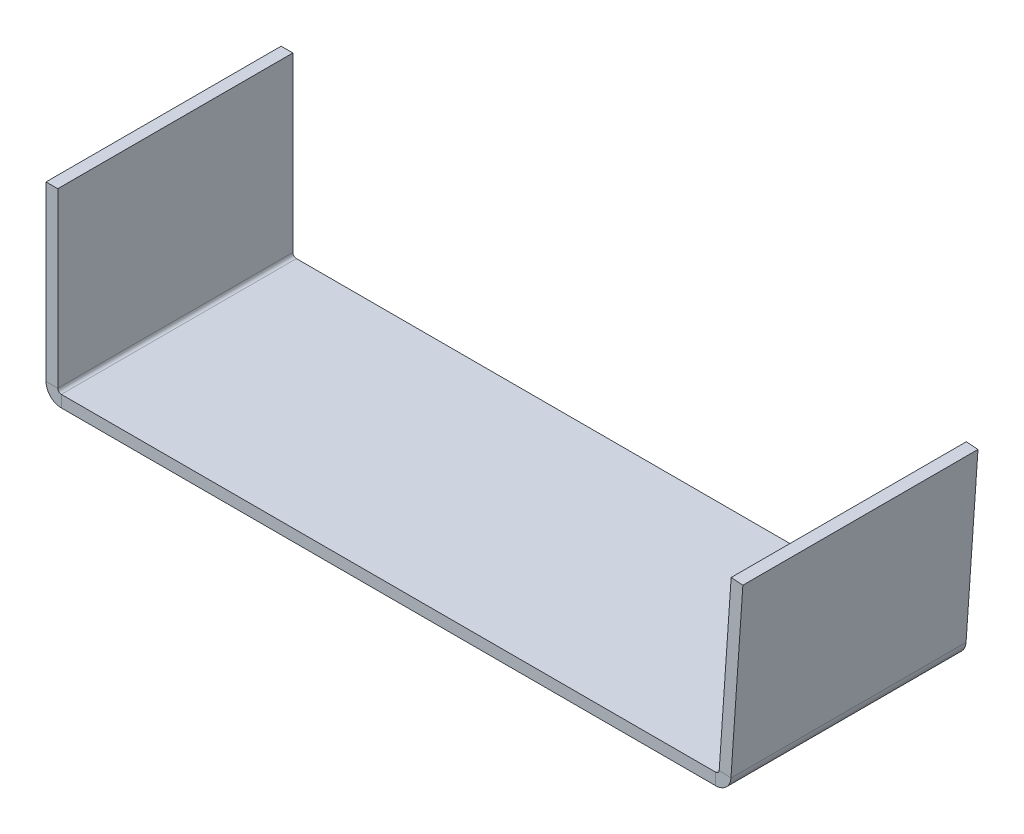
from build123d import *

# Parameters (mm, degrees)
BASE_FLANGE1_DEPTH = 40


# Sheet-metal steps are written as plain solids
with BuildPart() as part:
    # Sketch1 → Base-Flange1 (new body)
    with BuildSketch(Plane.XY):
        with BuildLine():
            Line((-58.181789665, 32.32321648), (-58.181789665, 2.927271587))
            ThreePointArc((-58.181789665, 2.927271587), (-58.006053734, 2.503007518), (-57.581789665, 2.327271587))
            Line((-57.581789665, 2.327271587), (53.742957817, 2.327271587))
            ThreePointArc((53.742957817, 2.327271587), (54.152366688, 2.488655152), (54.341536014, 2.885990332))
            Line((54.341536014, 2.885990332), (56.371689542, 32.32321648))
            Line((56.371689542, 32.32321648), (58.366950199, 32.185612297))
            Line((58.366950199, 32.185612297), (56.336796671, 2.748386148))
            ThreePointArc((56.336796671, 2.748386148), (55.517062924, 1.026600371), (53.742957817, 0.327271587))
            Line((53.742957817, 0.327271587), (-57.581789665, 0.327271587))
            ThreePointArc((-57.581789665, 0.327271587), (-59.420267296, 1.088793956), (-60.181789665, 2.927271587))
            Line((-60.181789665, 2.927271587), (-60.181789665, 32.32321648))
            Line((-60.181789665, 32.32321648), (-58.181789665, 32.32321648))
        make_face()
    extrude(amount=BASE_FLANGE1_DEPTH)


solid = part.part
